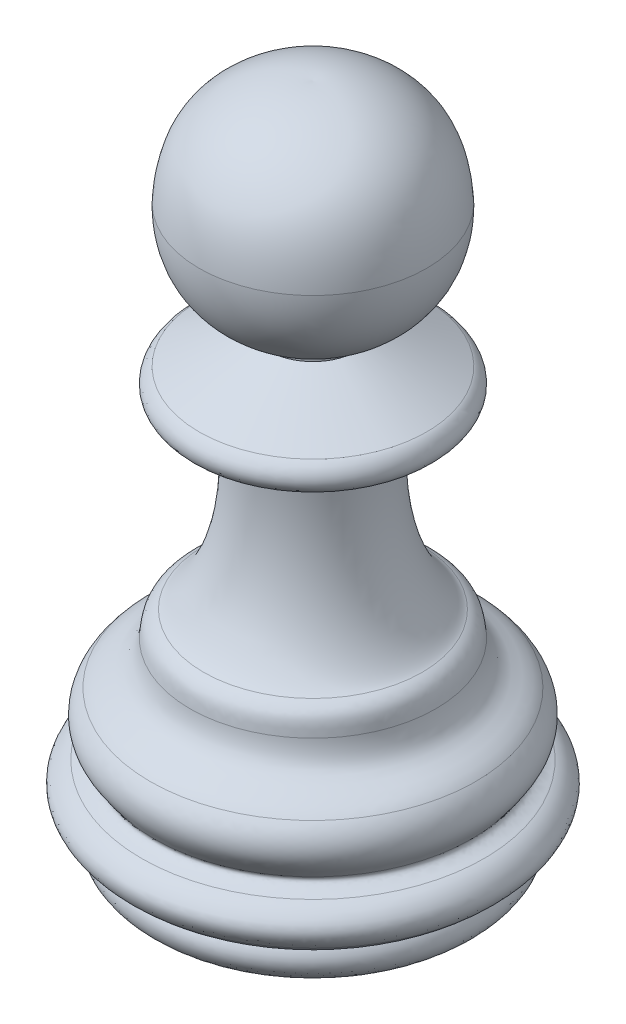
from build123d import *


with BuildPart() as part:
    # Sketch1 → Revolve2 (revolve)
    with BuildSketch(Plane.XY):
        with BuildLine():
            Line((0, 26.625071466), (0, 0))
            Line((0, 0), (5.543805409, 0))
            add(Edge.make_bspline(
                [(6.319793296, 1.525847677), (6.889302205, 0.686287118), (5.543805409, 0)],
                knots=[0, 0, 0, 1, 1, 1], degree=2))
            add(Edge.make_bspline(
                [(7.085307754, 2.055592338), (6.864738604, 1.829988787), (6.609567118, 1.653407233), (6.319793296, 1.525847677)],
                knots=[0, 0, 0, 0, 1, 1, 1, 1], degree=3))
            add(Edge.make_bspline(
                [(6.741362661, 3.478452892), (6.970710589, 3.391049286), (7.40122549, 3.03910509), (7.53941056, 2.520059856), (7.085307754, 2.055592338)],
                knots=[0, 0, 0, 0, 0.372722308, 1, 1, 1, 1], degree=3))
            add(Edge.make_bspline(
                [(6.247749325, 3.897860565), (6.218723376, 3.855258339), (6.183941334, 3.717754673), (6.445100579, 3.573341428), (6.690034137, 3.498013993), (6.741362661, 3.478452892)],
                knots=[0, 0, 0, 0, 0.162366513, 0.584346053, 1, 1, 1, 1], degree=3))
            add(Edge.make_bspline(
                [(6.402401794, 5.930190735), (6.784177677, 5.531343902), (6.951661459, 4.728187202), (6.426334589, 4.159975336), (6.247749325, 3.897860565)],
                knots=[0, 0, 0, 0, 0.588501572, 1, 1, 1, 1], degree=3))
            add(Edge.make_bspline(
                [(4.833967561, 7.625249343), (4.874718363, 7.30367232), (5.109048802, 6.449189117), (6.007021611, 6.343250178), (6.402401794, 5.930190735)],
                knots=[0, 0, 0, 0, 0.377644998, 1, 1, 1, 1], degree=3))
            add(Edge.make_bspline(
                [(4.301931531, 8.604902513), (4.459652634, 8.524803103), (4.778738537, 8.275930853), (4.799900285, 7.894084624), (4.833967561, 7.625249343)],
                knots=[0, 0, 0, 0, 0.408405695, 1, 1, 1, 1], degree=3))
            add(Edge.make_bspline(
                [(2.735852942, 15.689695119), (2.13635684, 11.136275765), (3.716131859, 8.902403651), (4.301931531, 8.604902513)],
                knots=[0, 0, 0, 0, 1, 1, 1, 1], degree=3))
            Line((2.735852942, 15.689695119), (4.146774256, 15.689695119))
            add(Edge.make_bspline(
                [(4.479001376, 16.888442397), (4.679498126, 16.786031007), (5.067202986, 16.164049956), (4.493493746, 15.689695119), (4.146774256, 15.689695119)],
                knots=[0, 0, 0, 0, 0.447467442, 1, 1, 1, 1], degree=3))
            Line((4.479001376, 16.888442397), (1.748997287, 18.282896499))
            Line((1.748997287, 18.282896499), (1.748997287, 18.519100682))
            add(Edge.make_bspline(
                [(4.479001376, 22.465552786), (4.493335744, 19.724714624), (1.748997287, 18.519100682)],
                knots=[0, 0, 0, 1, 1, 1], degree=2))
            add(Edge.make_bspline(
                [(0, 26.625071466), (1.261982799, 26.720448123), (3.78083459, 25.70244409), (4.410562491, 23.567274656), (4.479001376, 22.465552786)],
                knots=[0, 0, 0, 0, 0.57860408, 1, 1, 1, 1], degree=3))
        make_face()
    revolve(axis=Axis((0, 26.625071466, 0), (0, -1, 0)))


solid = part.part
